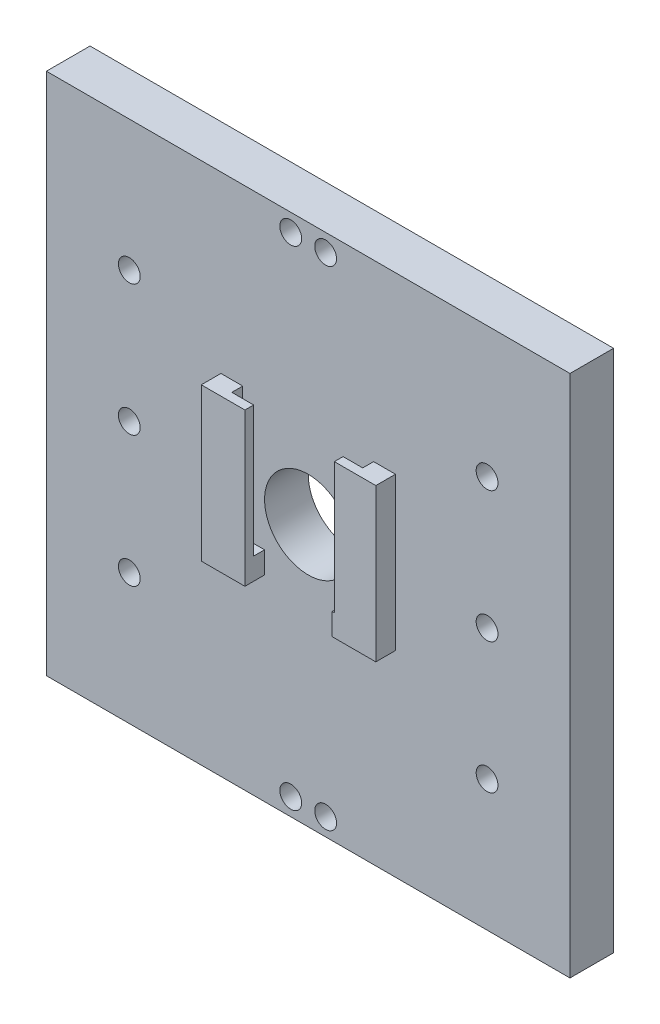
from build123d import *

# Parameters (mm, degrees)
SKETCH1_W           = 120
SKETCH1_H           = 10
BOSS_EXTRUDE1_DEPTH = 120
SKETCH2_R           = 10
SKETCH2_R_2         = 2.5
CUT_EXTRUDE1_DEPTH  = 10
BOSS_EXTRUDE2_DEPTH = 4.5
SKETCH3_W           = 2
SKETCH3_H           = 30
BOSS_EXTRUDE4_DEPTH = 5
SKETCH5_W           = 2
SKETCH5_H           = 30
BOSS_EXTRUDE5_DEPTH = 4.5


with BuildPart() as part:
    # Sketch1 → Boss-Extrude1 (new body)
    with BuildSketch(Plane(origin=(0, 0, 0), x_dir=(1, 0, 0), z_dir=(0, 1, 0))):
        Rectangle(SKETCH1_W, SKETCH1_H)
    extrude(amount=BOSS_EXTRUDE1_DEPTH)

    # Sketch2 → Cut-Extrude1 (cut)
    with BuildSketch(Plane.XY.offset(5)):
        with Locations((0, 60)):
            Circle(SKETCH2_R)
        with Locations((-41, 60)):
            Circle(SKETCH2_R_2)
        with Locations((-41, 30)):
            Circle(SKETCH2_R_2)
        with Locations((-41, 90)):
            Circle(SKETCH2_R_2)
        with Locations((41, 60)):
            Circle(SKETCH2_R_2)
        with Locations((41, 30)):
            Circle(SKETCH2_R_2)
        with Locations((41, 90)):
            Circle(SKETCH2_R_2)
        with Locations((-4, 116)):
            Circle(SKETCH2_R_2)
        with Locations((4, 116)):
            Circle(SKETCH2_R_2)
        with Locations((-4, 4)):
            Circle(SKETCH2_R_2)
        with Locations((4, 4)):
            Circle(SKETCH2_R_2)
    extrude(amount=-CUT_EXTRUDE1_DEPTH, mode=Mode.SUBTRACT)

    # Sketch2<4> → Boss-Extrude2 (add)
    with BuildSketch(Plane.XY.offset(5)):
        Polygon((-10, 50), (-15, 50), (-15, 80), (-20, 80), (-20, 45), (-10, 45), align=None)
        Polygon((15, 80), (15, 50), (10, 50), (10, 45), (20, 45), (20, 80), align=None)
    extrude(amount=BOSS_EXTRUDE2_DEPTH)

    # Sketch3 → Boss-Extrude4 (add)
    with BuildSketch(Plane(origin=(-15, 0, 0), x_dir=(0, 0, -1), z_dir=(1, 0, 0))):
        with Locations((-8.5, 65)):
            Rectangle(SKETCH3_W, SKETCH3_H)
    extrude(amount=BOSS_EXTRUDE4_DEPTH)

    # Sketch5 → Boss-Extrude5 (add)
    with BuildSketch(Plane.ZY.offset(-15)):
        with Locations((8.5, 65)):
            Rectangle(SKETCH5_W, SKETCH5_H)
    extrude(amount=BOSS_EXTRUDE5_DEPTH)


solid = part.part
